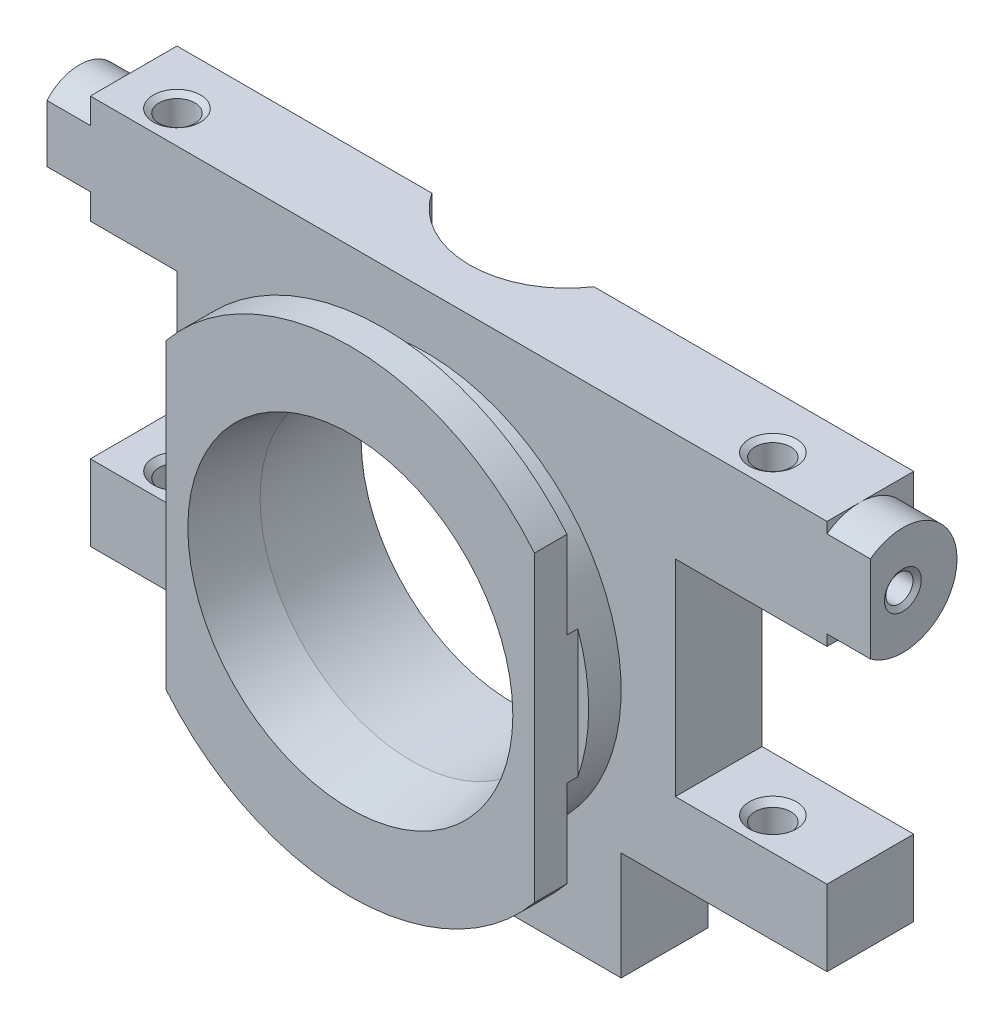
from build123d import *

# Parameters (mm, degrees)
SKETCH_1_W                 = 76
SKETCH_1_H                 = 46
EXTRUDE_1_DEPTH            = 15
CUT_EXTRUDE_1_REACH        = 92.094
SKETCH_2_R                 = 14
CUT_EXTRUDE_3_DEPTH        = 91.094394942
CUT_EXTRUDE_4_REACH        = 92.094
CUT_EXTRUDE_4_END_RADIUS   = 14
HOLE_WIZARD_M41_AT_2_COUNT = 2
HOLE_WIZARD_M41_AT_2_PITCH = 55
HOLE_WIZARD_M42_AT_2_COUNT = 2
HOLE_WIZARD_M42_AT_2_PITCH = 55
SKETCH_15_W                = 4
SKETCH_15_H                = 6.19823693
SKETCH_15_H_2              = 5.19823693
CUT_EXTRUDE_START          = -4
CUT_EXTRUDE_5_DEPTH        = 4


# Read off the part's stored shape, not the designer's step: Отверстие обработанное метчиком M31, Отверстие обработанное метчиком M32
with BuildPart() as part:
    # Эскиз1 → Бобышка-Вытянуть1 (new body)
    with BuildSketch(Plane.XY):
        with Locations((38, 23)):
            Rectangle(SKETCH_1_W, SKETCH_1_H)
    extrude(amount=EXTRUDE_1_DEPTH)

    # Эскиз2 → Вырез-Вытянуть1 (cut, up to next)
    with BuildSketch(Plane.XY.offset(15), mode=Mode.PRIVATE) as cut_extrude_1_sk1:
        with Locations((35, 23)):
            Circle(SKETCH_2_R)
    cut_extrude_1_tool1 = extrude(cut_extrude_1_sk1.sketch, amount=-CUT_EXTRUDE_1_REACH, mode=Mode.PRIVATE) & part.part
    add(cut_extrude_1_tool1.solids().sort_by_distance((35, 23, 15))[0], mode=Mode.SUBTRACT)

    # Эскиз3 → Вырез-Вытянуть3 (cut, through all)
    with BuildSketch(Plane.XY.offset(15)):
        Polygon((17, 10), (4, 10), (4, 17), (12, 17), (12, 36), (0, 36), (0, 0), (17, 0), align=None)
        Polygon((53, 10), (53, 0), (76, 0), (76, 36), (58, 36), (58, 17), (72, 17), (72, 10), align=None)
    extrude(amount=-CUT_EXTRUDE_3_DEPTH, mode=Mode.SUBTRACT)

    # Вырез-Вытянуть4: up to this cylinder (the profile starts outside it)
    cut_extrude_4_end = Plane(origin=(35, 23, 1.635023), z_dir=(0, 0, 1)) * Cylinder(CUT_EXTRUDE_4_END_RADIUS, 213.188, mode=Mode.PRIVATE)
    # Эскиз4 → Вырез-Вытянуть4 (cut, up to the surface)
    with BuildSketch(Plane(origin=(0, 46, 0), x_dir=(1, 0, 0), z_dir=(0, 1, 0)), mode=Mode.PRIVATE) as cut_extrude_4_sk1:
        with BuildLine():
            Line((42.483314774, 0), (27.516685226, 0))
            ThreePointArc((27.516685226, 0), (35, -4), (42.483314774, 0))
        make_face()
    cut_extrude_4_tool1 = extrude(cut_extrude_4_sk1.sketch, amount=-CUT_EXTRUDE_4_REACH, mode=Mode.PRIVATE) - cut_extrude_4_end
    add(cut_extrude_4_tool1.solids().sort_by_distance((35, 46, 1.635023))[0], mode=Mode.SUBTRACT)

    # Эскиз5 → Вырез-Повернуть1 (revolve, cut)
    with BuildSketch(Plane(origin=(0, 23, 0), x_dir=(-1, 0, 0), z_dir=(0, 1, 0)), mode=Mode.PRIVATE) as cut_revolve_1_sk:
        Polygon((15, 15), (-13, 15), (-13, 12), (-17, 12), (-17, 8), (15, 8), align=None)
        Polygon((-21.564689936, 15), (-20, 15), (-21.564689936, 6.126202411), align=None)
    revolve(cut_revolve_1_sk.sketch.rotate(Axis((35, 23, 0), (0, 0, 1)), 180), axis=Axis((35, 23, 0), (0, 0, 1)), mode=Mode.SUBTRACT)

    # Эскиз6 → Отверстие обработанное метчиком M41 (revolve, cut)
    with BuildSketch(Plane(origin=(9, 46, 5), x_dir=(0, 0, 1), z_dir=(1, 0, 0))):
        Polygon((0, 0), (0, 10), (2.175, 10), (1.65, 9.475), (1.65, 0.367608958), (2.175, 0), align=None)
    hole_wizard_m41 = revolve(axis=Axis((9, 52.35, 5), (0, -1, 0)), mode=Mode.SUBTRACT)

    # Отверстие обработанное метчиком M41 at 2: Отверстие обработанное метчиком M41 ×2
    with Locations(*[(i * HOLE_WIZARD_M41_AT_2_PITCH, 0, 0) for i in range(1, HOLE_WIZARD_M41_AT_2_COUNT)]):
        add(hole_wizard_m41, mode=Mode.SUBTRACT)

    # Эскиз8 → Отверстие обработанное метчиком M42 (revolve, cut)
    with BuildSketch(Plane(origin=(64, 10, 5), x_dir=(0, 0, -1), z_dir=(1, 0, 0))):
        Polygon((0, 0), (0, 7), (2.175, 7), (1.65, 6.475), (1.65, 0.367608958), (2.175, 0), align=None)
    hole_wizard_m42 = revolve(axis=Axis((64, 3.65, 5), (0, 1, 0)), mode=Mode.SUBTRACT)

    # Отверстие обработанное метчиком M42 at 2: Отверстие обработанное метчиком M42 ×2
    with Locations(*[(-i * HOLE_WIZARD_M42_AT_2_PITCH, 0, 0) for i in range(1, HOLE_WIZARD_M42_AT_2_COUNT)]):
        add(hole_wizard_m42, mode=Mode.SUBTRACT)

    # Отверстие обработанное метчиком M31 outline → Отверстие обработанное метчиком M31 (revolve, cut)
    with BuildSketch(Plane(origin=(0, 41, 5), x_dir=(0, 1, 0), z_dir=(0, 0, -1))):
        Polygon((1.25, 0.315093392), (1.25, 7.923293242), (0, 7.923293242), (0, 0), (1.7, 0), align=None)
    revolve(axis=Axis((0, 41, 5), (1, 0, 0)), mode=Mode.SUBTRACT)

    # Отверстие обработанное метчиком M32 outline → Отверстие обработанное метчиком M32 (revolve, cut)
    with BuildSketch(Plane(origin=(0, 41, 5), x_dir=(0, 1, 0), z_dir=(0, 0, -1))):
        Polygon((0, 65.076706758), (1.25, 65.076706758), (1.25, 75.684906608), (1.7, 76), (0, 76), align=None)
    revolve(axis=Axis((0, 41, 5), (1, 0, 0)), mode=Mode.SUBTRACT)

    # Эскиз15 → Вырез-Повернуть2 (revolve, cut)
    with BuildSketch(Plane(origin=(0, 0, 5), x_dir=(-1, 0, 0), z_dir=(0, 0, -1)), mode=Mode.PRIVATE) as cut_revolve_2_sk:
        with Locations((-2, 33.900881535)):
            Rectangle(SKETCH_15_W, SKETCH_15_H)
        with Locations((-74, 33.400881535)):
            Rectangle(SKETCH_15_W, SKETCH_15_H_2)
    revolve(cut_revolve_2_sk.sketch.rotate(Axis((8.006810355, 41, 5), (-1, 0, 0)), 270), axis=Axis((8.006810355, 41, 5), (-1, 0, 0)), mode=Mode.SUBTRACT)

    # Эскиз16 → Вырез-Вытянуть5 (cut)
    with BuildSketch(Plane.XY.offset(15).offset(CUT_EXTRUDE_START)):
        with BuildLine():
            Line((18, 9.035759956), (18, 36.964240044))
            ThreePointArc((18, 36.964240044), (13, 23), (18, 9.035759956))
        make_face()
        with BuildLine():
            ThreePointArc((57, 23), (55.712315177, 30.416198487), (52, 36.964240044))
            Line((52, 36.964240044), (52, 9.035759956))
            ThreePointArc((52, 9.035759956), (55.712315177, 15.583801513), (57, 23))
        make_face()
    extrude(amount=CUT_EXTRUDE_5_DEPTH, mode=Mode.SUBTRACT)


solid = part.part
